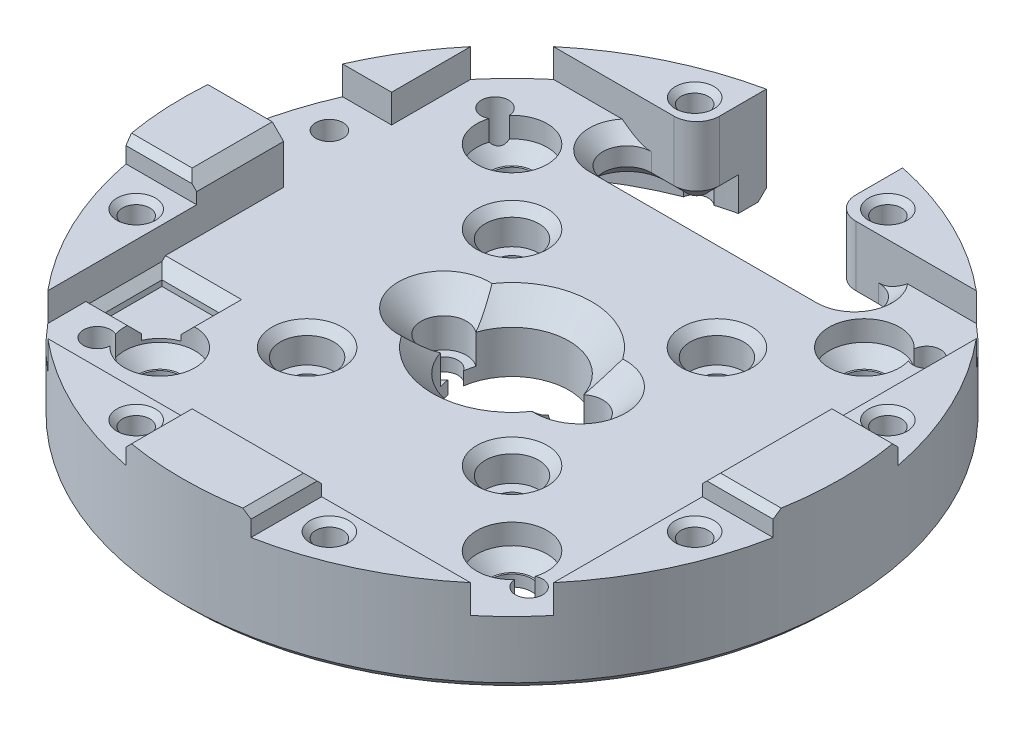
from build123d import *
from build123d.topology import SkipClean

# Parameters (mm, degrees)
SKETCH1_R           = 8.75
BOSS_EXTRUDE1_DEPTH = 1.75
SKETCH2_R           = 2
CUT_EXTRUDE1_DEPTH  = 0.6
SKETCH3_R           = 29
SKETCH3_R_2         = 1.2
BOSS_EXTRUDE2_DEPTH = 6.5
SKETCH4_W           = 44.5
SKETCH4_H           = 44.5
CUT_EXTRUDE2_DEPTH  = 2.5
CHAMFER1_SIZE       = 0.5
CHAMFER2_SIZE       = 2
BOSS_EXTRUDE3_START = 1.75
SKETCH10_R          = 29
SKETCH10_R_2        = 26.6
BOSS_EXTRUDE3_DEPTH = 1.75
SKETCH5_R           = 1.75
CUT_EXTRUDE3_DEPTH  = 42.413313077
SKETCH7_W           = 12
SKETCH7_H           = 24.342543846
CUT_EXTRUDE5_DEPTH  = 12
SKETCH11_R          = 2.35
CUT_EXTRUDE8_DEPTH  = 3
SKETCH8_W           = 5
SKETCH8_H           = 5
CUT_EXTRUDE6_DEPTH  = 1.5
SKETCH12_R          = 1.4
CUT_EXTRUDE9_DEPTH  = 42.379342672
FILLET2_R           = 3
CHAMFER6_SIZE       = 0.7
BOSS_EXTRUDE5_DEPTH = 2
SKETCH15_R          = 1.2
CUT_EXTRUDE10_DEPTH = 42.833748338
CHAMFER7_SIZE       = 0.75
CUT_EXTRUDE7_START  = -2.5
SKETCH9_W           = 16.08555233
SKETCH9_H           = 9.5
CUT_EXTRUDE7_DEPTH  = 4.5
SKETCH16_R          = 3.1
CUT_EXTRUDE11_DEPTH = 3
CHAMFER8_SIZE       = 1.2
CHAMFER9_SIZE       = 0.5
CHAMFER10_SIZE      = 1
CHAMFER11_SIZE      = 1
CUT_EXTRUDE12_DEPTH = 42.413313077
FILLET3_R           = 2
CHAMFER12_SIZE      = 1.2
CHAMFER13_SIZE      = 0.6


with BuildPart() as part:
    # Sketch1 → Boss-Extrude1 (new body)
    with BuildSketch(Plane(origin=(0, 0, 0), x_dir=(1, 0, 0), z_dir=(0, 1, 0))):
        with Locations(Location((0, 0, 0), (0, 0, 270))):
            Circle(SKETCH1_R)
        with BuildLine():
            ThreePointArc((-4.953125, -0.683046656), (0, -5), (4.953125, -0.683046656))
            ThreePointArc((4.953125, -0.683046656), (7.25, 0), (4.953125, 0.683046656))
            ThreePointArc((4.953125, 0.683046656), (0, 5), (-4.953125, 0.683046656))
            ThreePointArc((-4.953125, 0.683046656), (-7.25, 0), (-4.953125, -0.683046656))
        make_face(mode=Mode.SUBTRACT)
    extrude(amount=BOSS_EXTRUDE1_DEPTH)

    # Sketch2 → Cut-Extrude1 (cut)
    with BuildSketch(Plane(origin=(0, 1.75, 0), x_dir=(1, 0, 0), z_dir=(0, 1, 0))):
        with Locations((-6, 0)):
            Circle(SKETCH2_R)
        with Locations((6, 0)):
            Circle(SKETCH2_R)
    extrude(amount=-CUT_EXTRUDE1_DEPTH, mode=Mode.SUBTRACT)

    # Sketch3 → Boss-Extrude2 (add)
    with BuildSketch(Plane.XZ.offset(-1.75)):
        with Locations(Location((0, 0, 0), (0, 0, 270))):
            Circle(SKETCH3_R)
        with Locations(Location((19, 17.5, 0), (0, 0, 270))):
            Circle(SKETCH3_R_2, mode=Mode.SUBTRACT)
        with Locations(Location((19, -17.5, 0), (0, 0, 270))):
            Circle(SKETCH3_R_2, mode=Mode.SUBTRACT)
        with Locations(Location((-19, -17.5, 0), (0, 0, 270))):
            Circle(SKETCH3_R_2, mode=Mode.SUBTRACT)
        with Locations(Location((-19, 17.5, 0), (0, 0, 270))):
            Circle(SKETCH3_R_2, mode=Mode.SUBTRACT)
        with BuildLine():
            ThreePointArc((-4.75, -1.5612495), (0, -5), (4.75, -1.5612495))
            ThreePointArc((4.75, -1.5612495), (8, 0), (4.75, 1.5612495))
            ThreePointArc((4.75, 1.5612495), (0, 5), (-4.75, 1.5612495))
            ThreePointArc((-4.75, 1.5612495), (-8, 0), (-4.75, -1.5612495))
        make_face(mode=Mode.SUBTRACT)
    extrude(amount=-BOSS_EXTRUDE2_DEPTH)

    # Sketch4 → Cut-Extrude2 (cut)
    with BuildSketch(Plane(origin=(0, 8.25, 0), x_dir=(1, 0, 0), z_dir=(0, 1, 0))):
        Rectangle(SKETCH4_W, SKETCH4_H)
    extrude(amount=-CUT_EXTRUDE2_DEPTH, mode=Mode.SUBTRACT)

    # Chamfer1
    chamfer1_edges = [part.edges().sort_by_distance(p)[0] for p in [
        (0, 0, -8.75),
    ]]
    chamfer(chamfer1_edges, length=CHAMFER1_SIZE)

    # Chamfer2
    chamfer2_edges = [part.edges().sort_by_distance(p)[0] for p in [
        (0, 5.75, -5),
        (0, 5.75, 5),
        (8, 5.75, 0),
        (-8, 5.75, 0),
    ]]
    chamfer(chamfer2_edges, length=CHAMFER2_SIZE)

    # Sketch10 → Boss-Extrude3 (add)
    with BuildSketch(Plane.XZ.offset(-1.75).offset(BOSS_EXTRUDE3_START)):
        with Locations(Location((0, 0, 0), (0, 0, 270))):
            Circle(SKETCH10_R)
        with Locations(Location((0, 0, 0), (0, 0, 44.660730664))):
            Circle(SKETCH10_R_2, mode=Mode.SUBTRACT)
    extrude(amount=-BOSS_EXTRUDE3_DEPTH)

    # Sketch5 → Cut-Extrude3 (cut, through all)
    with BuildSketch(Plane(origin=(0, 5.75, 0), x_dir=(1, 0, 0), z_dir=(0, 1, 0))):
        with Locations(Location((-15.499780644, 15.499780644, 0), (0, 0, 270))):
            Circle(SKETCH5_R)
        with Locations(Location((15.499780644, 15.499780644, 0), (0, 0, 270))):
            Circle(SKETCH5_R)
        with Locations(Location((15.499780644, -15.499780644, 0), (0, 0, 270))):
            Circle(SKETCH5_R)
        with Locations(Location((-15.499780644, -15.499780644, 0), (0, 0, 270))):
            Circle(SKETCH5_R)
    extrude(amount=-CUT_EXTRUDE3_DEPTH, mode=Mode.SUBTRACT)

    # Sketch7 → Cut-Extrude5 (cut)
    with BuildSketch(Plane(origin=(0, 8.25, 0), x_dir=(1, 0, 0), z_dir=(0, 1, 0))):
        with Locations((0, 30.171271923)):
            Rectangle(SKETCH7_W, SKETCH7_H)
    extrude(amount=-CUT_EXTRUDE5_DEPTH, mode=Mode.SUBTRACT)

    # Sketch11 → Cut-Extrude8 (cut)
    with BuildSketch(Plane(origin=(0, 5.75, 0), x_dir=(1, 0, 0), z_dir=(0, 1, 0))):
        with Locations(Location((-9.01561146, 9.01561146, 0), (0, 0, 270))):
            Circle(SKETCH11_R)
        with Locations(Location((9.01561146, 9.01561146, 0), (0, 0, 270))):
            Circle(SKETCH11_R)
        with Locations(Location((9.01561146, -9.01561146, 0), (0, 0, 270))):
            Circle(SKETCH11_R)
        with Locations(Location((-9.01561146, -9.01561146, 0), (0, 0, 270))):
            Circle(SKETCH11_R)
    extrude(amount=-CUT_EXTRUDE8_DEPTH, mode=Mode.SUBTRACT)

    # Sketch8 → Cut-Extrude6 (cut)
    with BuildSketch(Plane(origin=(0, 5.75, 0), x_dir=(1, 0, 0), z_dir=(0, 1, 0))):
        with Locations((-19.05, -11.75)):
            Rectangle(SKETCH8_W, SKETCH8_H)
    extrude(amount=-CUT_EXTRUDE6_DEPTH, mode=Mode.SUBTRACT)

    # Sketch12 → Cut-Extrude9 (cut, through all)
    with BuildSketch(Plane(origin=(0, 2.75, 0), x_dir=(1, 0, 0), z_dir=(0, 1, 0))):
        with Locations(Location((-9.01561146, 9.01561146, 0), (0, 0, 270))):
            Circle(SKETCH12_R)
        with Locations(Location((9.01561146, 9.01561146, 0), (0, 0, 270))):
            Circle(SKETCH12_R)
        with Locations(Location((9.01561146, -9.01561146, 0), (0, 0, 270))):
            Circle(SKETCH12_R)
        with Locations(Location((-9.01561146, -9.01561146, 0), (0, 0, 270))):
            Circle(SKETCH12_R)
    extrude(amount=-CUT_EXTRUDE9_DEPTH, mode=Mode.SUBTRACT)

    # Fillet2
    fillet2_edges = [part.edges().sort_by_distance(p)[0] for p in [
        (6, 3.75, -18),
        (-6, 3.75, -18),
    ]]
    fillet(fillet2_edges, radius=FILLET2_R)

    # Chamfer6
    chamfer6_edges = [part.edges().sort_by_distance(p)[0] for p in [
        (0, 0, 29),
    ]]
    chamfer(chamfer6_edges, length=CHAMFER6_SIZE)

    # Sketch14 → Boss-Extrude5 (add)
    with SkipClean():  # the faces are left unmerged after this step: merging them gives an invalid solid
        with BuildSketch(Plane(origin=(0, 8.25, 0), x_dir=(1, 0, 0), z_dir=(0, 1, 0))):
            with BuildLine():
                Line((22.25, 5.5), (22.25, -5.5))
                Line((22.25, -5.5), (28.47367205, -5.5))
                ThreePointArc((28.47367205, -5.5), (29, 0), (28.47367205, 5.5))
                Line((28.47367205, 5.5), (22.25, 5.5))
            make_face()
            with BuildLine():
                Line((5.5, -22.25), (-5.5, -22.25))
                Line((-5.5, -22.25), (-5.5, -28.47367205))
                ThreePointArc((-5.5, -28.47367205), (0, -29), (5.5, -28.47367205))
                Line((5.5, -28.47367205), (5.5, -22.25))
            make_face()
            with BuildLine():
                Line((-22.25, -5.5), (-22.25, 5.5))
                Line((-22.25, 5.5), (-28.47367205, 5.5))
                ThreePointArc((-28.47367205, 5.5), (-29, 0), (-28.47367205, -5.5))
                Line((-28.47367205, -5.5), (-22.25, -5.5))
            make_face()
        extrude(amount=BOSS_EXTRUDE5_DEPTH)

    # Sketch15 → Cut-Extrude10 (cut, through all)
    with SkipClean():  # the faces are left unmerged after this step: merging them gives an invalid solid
        with BuildSketch(Plane(origin=(0, 8.25, 0), x_dir=(1, 0, 0), z_dir=(0, 1, 0))):
            with Locations(Location((24.571324751, 8.5, 0), (0, 0, 270))):
                Circle(SKETCH15_R)
            with Locations(Location((24.571324751, -8.5, 0), (0, 0, 270))):
                Circle(SKETCH15_R)
            with Locations(Location((8.5, -24.571324751, 0), (0, 0, 270))):
                Circle(SKETCH15_R)
            with Locations(Location((-8.5, -24.571324751, 0), (0, 0, 270))):
                Circle(SKETCH15_R)
            with Locations(Location((-24.571324751, -8.5, 0), (0, 0, 270))):
                Circle(SKETCH15_R)
            with Locations(Location((-24.571324751, 8.5, 0), (0, 0, 270))):
                Circle(SKETCH15_R)
            with Locations(Location((-8.5, 24.571324751, 0), (0, 0, 270))):
                Circle(SKETCH15_R)
            with Locations(Location((8.5, 24.571324751, 0), (0, 0, 270))):
                Circle(SKETCH15_R)
        extrude(amount=-CUT_EXTRUDE10_DEPTH, mode=Mode.SUBTRACT)

    # Chamfer7
    chamfer7_edges = [part.edges().sort_by_distance(p)[0] for p in [
        (-9.01561146, 5.75, 6.66561146),
        (9.01561146, 5.75, 6.66561146),
        (9.01561146, 5.75, -11.36561146),
        (-9.01561146, 5.75, -11.36561146),
    ]]
    chamfer(chamfer7_edges, length=CHAMFER7_SIZE)

    # Sketch9 → Cut-Extrude7 (cut)
    with SkipClean():  # the faces are left unmerged after this step: merging them gives an invalid solid
        with BuildSketch(Plane(origin=(0, 8.25, 0), x_dir=(1, 0, 0), z_dir=(0, 1, 0)).offset(CUT_EXTRUDE7_START)):
            with Locations((-27.18622894, 6.9)):
                Rectangle(SKETCH9_W, SKETCH9_H)
        extrude(amount=CUT_EXTRUDE7_DEPTH, mode=Mode.SUBTRACT)

    # Sketch16 → Cut-Extrude11 (cut)
    with SkipClean():  # the faces are left unmerged after this step: merging them gives an invalid solid
        with BuildSketch(Plane(origin=(0, 5.75, 0), x_dir=(1, 0, 0), z_dir=(0, 1, 0))):
            with Locations((-15.499780644, 15.499780644)):
                Circle(SKETCH16_R)
            with Locations((15.499780644, 15.499780644)):
                Circle(SKETCH16_R)
            with Locations((15.499780644, -15.499780644)):
                Circle(SKETCH16_R)
            with Locations((-15.499780644, -15.499780644)):
                Circle(SKETCH16_R)
        extrude(amount=-CUT_EXTRUDE11_DEPTH, mode=Mode.SUBTRACT)

    # Chamfer8
    # the kernel refuses this chamfer: 1.2 mm, written as the material it adds along each edge
    with BuildSketch(Plane(origin=(-15.499780644, 2.75, -15.499780644), x_dir=(-0.26542411550444084, 0, -0.9641317539157629), z_dir=(0.9641317539157629, 0, -0.26542411550444084))) as chamfer8_piece_1_section:
        Polygon((3.1, CHAMFER8_SIZE), (3.1 - CHAMFER8_SIZE, 0), (3.1, 0), align=None)
    chamfer8_piece_1 = revolve(axis=Axis((-15.499780644, 2.75, -15.499780644), (0, 1, 0)), revolution_arc=254.607844674, mode=Mode.PRIVATE)
    chamfer8_piece_1 = chamfer8_piece_1 - Plane(origin=(-19, 3.335180824, -17.5), x_dir=(0, 0, -1), z_dir=(0, -1, 0)) * Cylinder(1.2, 13, mode=Mode.PRIVATE)
    add(chamfer8_piece_1)
    with BuildSketch(Plane(origin=(-15.499780644, 2.75, 15.499780644), x_dir=(1, 0, 0), z_dir=(0, 0, 1))) as chamfer8_piece_2_section:
        Polygon((3.1, CHAMFER8_SIZE), (3.1 - CHAMFER8_SIZE, 0), (3.1, 0), align=None)
    chamfer8_piece_2 = revolve(axis=Axis((-15.499780644, 2.75, 15.499780644), (0, 1, 0)), revolution_arc=254.607844674, mode=Mode.PRIVATE)
    chamfer8_piece_2 = chamfer8_piece_2 - Plane(origin=(-19, 3.335180824, 17.5), x_dir=(0, 0, -1), z_dir=(0, -1, 0)) * Cylinder(1.2, 13, mode=Mode.PRIVATE)
    add(chamfer8_piece_2)
    with BuildSketch(Plane(origin=(15.499780644, 2.75, 15.499780644), x_dir=(1, 0, 0), z_dir=(0, 0, 1))) as chamfer8_piece_3_section:
        Polygon((3.1, CHAMFER8_SIZE), (3.1 - CHAMFER8_SIZE, 0), (3.1, 0), align=None)
    chamfer8_piece_3 = revolve(axis=Axis((15.499780644, 2.75, 15.499780644), (0, 1, 0)), revolution_arc=359.64, mode=Mode.PRIVATE)
    chamfer8_piece_3 = chamfer8_piece_3 - Plane(origin=(19, 3.333317196, 17.5), x_dir=(0, 0, -1), z_dir=(0, -1, 0)) * Cylinder(1.2, 13, mode=Mode.PRIVATE)
    add(chamfer8_piece_3)
    with BuildSketch(Plane(origin=(15.499780644, 2.75, -15.499780644), x_dir=(0.9999802608561372, 0, -0.00628314396555981), z_dir=(0.00628314396555981, 0, 0.9999802608561372))) as chamfer8_piece_4_section:
        Polygon((3.1, CHAMFER8_SIZE), (3.1 - CHAMFER8_SIZE, 0), (3.1, 0), align=None)
    chamfer8_piece_4 = revolve(axis=Axis((15.499780644, 2.75, -15.499780644), (0, 1, 0)), revolution_arc=359.64, mode=Mode.PRIVATE)
    chamfer8_piece_4 = chamfer8_piece_4 - Plane(origin=(19, 3.333317196, -17.5), x_dir=(0, 0, -1), z_dir=(0, -1, 0)) * Cylinder(1.2, 13, mode=Mode.PRIVATE)
    add(chamfer8_piece_4)
    with BuildSketch(Plane(origin=(15.499780644, 2.75, -15.499780644), x_dir=(1, 0, 0), z_dir=(0, 0, 1))) as chamfer8_piece_5_section:
        Polygon((3.1, CHAMFER8_SIZE), (3.1 - CHAMFER8_SIZE, 0), (3.1, 0), align=None)
    chamfer8_piece_5 = revolve(axis=Axis((15.499780644, 2.75, -15.499780644), (0, 1, 0)), revolution_arc=74.498296466, mode=Mode.PRIVATE)
    chamfer8_piece_5 = chamfer8_piece_5 - Plane(origin=(19, 3.144218853, -17.5), x_dir=(0, 0, -1), z_dir=(0, -1, 0)) * Cylinder(1.2, 13, mode=Mode.PRIVATE)
    add(chamfer8_piece_5)
    with BuildSketch(Plane(origin=(15.499780644, 2.75, 15.499780644), x_dir=(0.2672670268853943, 0, 0.9636225071779104), z_dir=(-0.9636225071779104, 0, 0.2672670268853943))) as chamfer8_piece_6_section:
        Polygon((3.1, CHAMFER8_SIZE), (3.1 - CHAMFER8_SIZE, 0), (3.1, 0), align=None)
    chamfer8_piece_6 = revolve(axis=Axis((15.499780644, 2.75, 15.499780644), (0, 1, 0)), revolution_arc=74.498296466, mode=Mode.PRIVATE)
    chamfer8_piece_6 = chamfer8_piece_6 - Plane(origin=(19, 3.144218851, 17.5), x_dir=(0, 0, -1), z_dir=(0, -1, 0)) * Cylinder(1.2, 13, mode=Mode.PRIVATE)
    add(chamfer8_piece_6)
    with BuildSketch(Plane(origin=(-15.499780644, 2.75, 15.499780644), x_dir=(-0.9656578143230343, 0, -0.2598172158207769), z_dir=(0.2598172158207769, 0, -0.9656578143230343))) as chamfer8_piece_7_section:
        Polygon((3.1, CHAMFER8_SIZE), (3.1 - CHAMFER8_SIZE, 0), (3.1, 0), align=None)
    chamfer8_piece_7 = revolve(axis=Axis((-15.499780644, 2.75, 15.499780644), (0, 1, 0)), revolution_arc=195.059216658, mode=Mode.PRIVATE)
    chamfer8_piece_7 = chamfer8_piece_7 - Plane(origin=(-19, 3.336487733, 17.5), x_dir=(0, 0, -1), z_dir=(0, -1, 0)) * Cylinder(1.2, 13, mode=Mode.PRIVATE)
    add(chamfer8_piece_7)
    with BuildSketch(Plane(origin=(-15.499780644, 2.75, -15.499780644), x_dir=(1, 0, 0), z_dir=(0, 0, 1))) as chamfer8_piece_8_section:
        Polygon((3.1, CHAMFER8_SIZE), (3.1 - CHAMFER8_SIZE, 0), (3.1, 0), align=None)
    chamfer8_piece_8 = revolve(axis=Axis((-15.499780644, 2.75, -15.499780644), (0, 1, 0)), revolution_arc=195.059216658, mode=Mode.PRIVATE)
    chamfer8_piece_8 = chamfer8_piece_8 - Plane(origin=(-19, 3.336487733, -17.5), x_dir=(0, 0, -1), z_dir=(0, -1, 0)) * Cylinder(1.2, 13, mode=Mode.PRIVATE)
    add(chamfer8_piece_8)

    # Chamfer9
    chamfer9_edges = [part.edges().sort_by_distance(p)[0] for p in [
        (8.5, 8.25, -25.771324751),
        (-8.5, 8.25, -25.771324751),
        (-24.571324751, 8.25, 7.3),
        (-8.5, 8.25, 23.371324751),
        (8.5, 8.25, 23.371324751),
        (24.571324751, 8.25, 7.3),
        (24.571324751, 8.25, -9.7),
    ]]
    chamfer(chamfer9_edges, length=CHAMFER9_SIZE)

    # Chamfer10
    # the kernel refuses this chamfer: 1 mm, written as the material it takes off along each edge
    with BuildSketch(Plane(origin=(-16.55, 5.75, 9.25), x_dir=(0, 0.02749587661058651, -0.9996219169112968), z_dir=(-1, 0, 0))) as chamfer10_piece_1:
        Polygon((CHAMFER10_SIZE * 0.999621916911, CHAMFER10_SIZE * 0.0274958766106), (-CHAMFER10_SIZE * 0.0274958766106, CHAMFER10_SIZE * 0.999621916911), (0, 0), align=None)
    extrude(amount=5, mode=Mode.SUBTRACT)
    with BuildSketch(Plane(origin=(-21.55, 5.75, 9.25), x_dir=(-0.9996219169112968, 0.02749587661058651, 0), z_dir=(0, 0, 1))) as chamfer10_piece_2_section:
        Polygon((CHAMFER10_SIZE * 0.999621916911, CHAMFER10_SIZE * 0.0274958766106), (-CHAMFER10_SIZE * 0.0274958766106, CHAMFER10_SIZE * 0.999621916911), (0, 0), align=None)
    chamfer10_piece_2 = extrude(amount=5, mode=Mode.PRIVATE)
    chamfer10_piece_2 = split(chamfer10_piece_2, bisect_by=Plane(origin=(-22.25, 5.391032251, 11.75), z_dir=(1, 0, 0)), keep=Keep.TOP, mode=Mode.PRIVATE)
    add(chamfer10_piece_2, mode=Mode.SUBTRACT)
    with BuildSketch(Plane(origin=(-21.55, 5.75, 14.25), x_dir=(0, 0.02749587661058651, 0.9996219169112968), z_dir=(1, 0, 0))) as chamfer10_piece_3:
        Polygon((CHAMFER10_SIZE * 0.999621916911, CHAMFER10_SIZE * 0.0274958766106), (-CHAMFER10_SIZE * 0.0274958766106, CHAMFER10_SIZE * 0.999621916911), (0, 0), align=None)
    extrude(amount=5.784994108, mode=Mode.SUBTRACT)
    with BuildSketch(Plane(origin=(-16.55, 5.75, 15.154780703), x_dir=(0.9996219169112968, 0.02749587661058651, 0), z_dir=(0, 0, -1))) as chamfer10_piece_4:
        Polygon((CHAMFER10_SIZE * 0.999621916911, CHAMFER10_SIZE * 0.0274958766106), (-CHAMFER10_SIZE * 0.0274958766106, CHAMFER10_SIZE * 0.999621916911), (0, 0), align=None)
    extrude(amount=5.904780703, mode=Mode.SUBTRACT)
    with BuildSketch(Plane(origin=(-16.55, 5.75, 15.154780703), x_dir=(0.9996219169112968, 0.02749587661058651, 0), z_dir=(0, 0, -1))) as chamfer10_piece_5a_section:
        Polygon((CHAMFER10_SIZE * 0.999621916911, CHAMFER10_SIZE * 0.0274958766106), (-CHAMFER10_SIZE * 0.0274958766106, CHAMFER10_SIZE * 0.999621916911), (0, 0), align=None)
    chamfer10_piece_5a = extrude(amount=8.476463691, mode=Mode.PRIVATE)
    chamfer10_piece_5a = split(chamfer10_piece_5a, bisect_by=Plane(origin=(-16.220206373, 5.420206373, 9.25), z_dir=(0, 0, -1)), keep=Keep.TOP, mode=Mode.PRIVATE)
    with BuildSketch(Plane(origin=(-13.978317012, 5.75, 9.25), x_dir=(0, 0.02749587661058651, -0.9996219169112968), z_dir=(-1, 0, 0))) as chamfer10_piece_5b_section:
        Polygon((CHAMFER10_SIZE * 0.999621916911, CHAMFER10_SIZE * 0.0274958766106), (-CHAMFER10_SIZE * 0.0274958766106, CHAMFER10_SIZE * 0.999621916911), (0, 0), align=None)
    chamfer10_piece_5b = extrude(amount=7.571682988, mode=Mode.PRIVATE)
    chamfer10_piece_5b = split(chamfer10_piece_5b, bisect_by=Plane(origin=(-16.55, 5.420206373, 8.920206373), z_dir=(1, 0, 0)), keep=Keep.TOP, mode=Mode.PRIVATE)
    chamfer10_piece_5 = chamfer10_piece_5a & chamfer10_piece_5b
    add(chamfer10_piece_5, mode=Mode.SUBTRACT)
    with BuildSketch(Plane(origin=(-16.55, 5.75, 9.25), x_dir=(0, 0.02749587661058651, -0.9996219169112968), z_dir=(-1, 0, 0))) as chamfer10_piece_6a_section:
        Polygon((CHAMFER10_SIZE * 0.999621916911, CHAMFER10_SIZE * 0.0274958766106), (-CHAMFER10_SIZE * 0.0274958766106, CHAMFER10_SIZE * 0.999621916911), (0, 0), align=None)
    chamfer10_piece_6a = extrude(amount=7.571682988, mode=Mode.PRIVATE)
    chamfer10_piece_6a = split(chamfer10_piece_6a, bisect_by=Plane(origin=(-22.25, 5.420206373, 8.920206373), z_dir=(1, 0, 0)), keep=Keep.TOP, mode=Mode.PRIVATE)
    chamfer10_piece_6a = split(chamfer10_piece_6a, bisect_by=Plane(origin=(-21.55, 5.420206373, 8.920206373), z_dir=(-1, 0, 0)), keep=Keep.TOP, mode=Mode.PRIVATE)
    with BuildSketch(Plane(origin=(-21.55, 5.75, 6.678317012), x_dir=(-0.9996219169112968, 0.02749587661058651, 0), z_dir=(0, 0, 1))) as chamfer10_piece_6b_section:
        Polygon((CHAMFER10_SIZE * 0.999621916911, CHAMFER10_SIZE * 0.0274958766106), (-CHAMFER10_SIZE * 0.0274958766106, CHAMFER10_SIZE * 0.999621916911), (0, 0), align=None)
    chamfer10_piece_6b = extrude(amount=7.571682988, mode=Mode.PRIVATE)
    chamfer10_piece_6b = split(chamfer10_piece_6b, bisect_by=Plane(origin=(-22.25, 5.391032251, 7.964158506), z_dir=(1, 0, 0)), keep=Keep.TOP, mode=Mode.PRIVATE)
    chamfer10_piece_6b = split(chamfer10_piece_6b, bisect_by=Plane(origin=(-21.824069638, 5.391032251, 9.25), z_dir=(0, 0, -1)), keep=Keep.TOP, mode=Mode.PRIVATE)
    chamfer10_piece_6 = chamfer10_piece_6a & chamfer10_piece_6b
    add(chamfer10_piece_6, mode=Mode.SUBTRACT)
    with BuildSketch(Plane(origin=(-21.55, 5.75, 9.25), x_dir=(-0.9996219169112968, 0.02749587661058651, 0), z_dir=(0, 0, 1))) as chamfer10_piece_7a_section:
        Polygon((CHAMFER10_SIZE * 0.999621916911, CHAMFER10_SIZE * 0.0274958766106), (-CHAMFER10_SIZE * 0.0274958766106, CHAMFER10_SIZE * 0.999621916911), (0, 0), align=None)
    chamfer10_piece_7a = extrude(amount=7.571682988, mode=Mode.PRIVATE)
    chamfer10_piece_7a = split(chamfer10_piece_7a, bisect_by=Plane(origin=(-22.25, 5.391032251, 15.535841494), z_dir=(1, 0, 0)), keep=Keep.TOP, mode=Mode.PRIVATE)
    chamfer10_piece_7a = split(chamfer10_piece_7a, bisect_by=Plane(origin=(-21.824069638, 5.391032251, 14.25), z_dir=(0, 0, 1)), keep=Keep.TOP, mode=Mode.PRIVATE)
    with BuildSketch(Plane(origin=(-24.121682988, 5.75, 14.25), x_dir=(0, 0.02749587661058651, 0.9996219169112968), z_dir=(1, 0, 0))) as chamfer10_piece_7b_section:
        Polygon((CHAMFER10_SIZE * 0.999621916911, CHAMFER10_SIZE * 0.0274958766106), (-CHAMFER10_SIZE * 0.0274958766106, CHAMFER10_SIZE * 0.999621916911), (0, 0), align=None)
    chamfer10_piece_7b = extrude(amount=8.356677096, mode=Mode.PRIVATE)
    chamfer10_piece_7b = split(chamfer10_piece_7b, bisect_by=Plane(origin=(-22.25, 5.420206373, 14.579793627), z_dir=(1, 0, 0)), keep=Keep.TOP, mode=Mode.PRIVATE)
    chamfer10_piece_7b = split(chamfer10_piece_7b, bisect_by=Plane(origin=(-21.55, 5.420206373, 14.579793627), z_dir=(-1, 0, 0)), keep=Keep.TOP, mode=Mode.PRIVATE)
    chamfer10_piece_7 = chamfer10_piece_7a & chamfer10_piece_7b
    add(chamfer10_piece_7, mode=Mode.SUBTRACT)

    # Chamfer11
    chamfer11_edges = [part.edges().sort_by_distance(p)[0] for p in [
        (22.25, 10.25, 0),
        (0, 10.25, 22.25),
        (-22.25, 10.25, 1.675),
    ]]
    chamfer(chamfer11_edges, length=CHAMFER11_SIZE)

    # Sketch17 → Cut-Extrude12 (cut, through all)
    with BuildSketch(Plane(origin=(0, 5.75, 0), x_dir=(1, 0, 0), z_dir=(0, 1, 0))):
        with BuildLine():
            Line((-10, 22.25), (10, 22.25))
            ThreePointArc((10, 22.25), (12.125, 20.125), (10, 18))
            Line((10, 18), (-10, 18))
            ThreePointArc((-10, 18), (-12.125, 20.125), (-10, 22.25))
        make_face()
    extrude(amount=-CUT_EXTRUDE12_DEPTH, mode=Mode.SUBTRACT)

    # Fillet3
    fillet3_edges = [part.edges().sort_by_distance(p)[0] for p in [
        (6, 3.75, -22.25),
        (-6, 3.75, -22.25),
    ]]
    fillet(fillet3_edges, radius=FILLET3_R)

    # Chamfer12
    # the kernel refuses this chamfer: 1.2 mm, written as the material it takes off along each edge
    with BuildSketch(Plane(origin=(6, 1.75, -24.25), x_dir=(-0.027495876610586632, 0.9996219169112968, 0), z_dir=(0, 0, -1))) as chamfer12_piece_1_section:
        Polygon((CHAMFER12_SIZE * 0.999621916911, CHAMFER12_SIZE * 0.0274958766106), (-CHAMFER12_SIZE * 0.0274958766106, CHAMFER12_SIZE * 0.999621916911), (0, 0), align=None)
    chamfer12_piece_1 = extrude(amount=4.750494305, mode=Mode.PRIVATE)
    chamfer12_piece_1 = chamfer12_piece_1 & Plane(origin=(0, 2.261864146, 0), x_dir=(0.7112813989926423, 0, 0.7029073704600554), z_dir=(0, -1, 0)) * Cylinder(26.6, 15, mode=Mode.PRIVATE)
    add(chamfer12_piece_1, mode=Mode.SUBTRACT)
    with BuildSketch(Plane(origin=(-3, 1.75, -18), x_dir=(0, 0.9996219169112968, -0.027495876610587354), z_dir=(1, 0, 0))) as chamfer12_piece_2:
        Polygon((CHAMFER12_SIZE * 0.999621916911, CHAMFER12_SIZE * 0.0274958766106), (-CHAMFER12_SIZE * 0.0274958766106, CHAMFER12_SIZE * 0.999621916911), (0, 0), align=None)
    extrude(amount=6, mode=Mode.SUBTRACT)
    with BuildSketch(Plane(origin=(-3, 5.75, -18), x_dir=(0, -0.9996219169112968, -0.027495876610587344), z_dir=(1, 0, 0))) as chamfer12_piece_3:
        Polygon((CHAMFER12_SIZE * 0.999621916911, -CHAMFER12_SIZE * 0.0274958766106), (-CHAMFER12_SIZE * 0.0274958766106, -CHAMFER12_SIZE * 0.999621916911), (0, 0), align=None)
    extrude(amount=6, mode=Mode.SUBTRACT)
    with BuildSketch(Plane(origin=(-10, 1.75, -20.125), x_dir=(0, 0, -1), z_dir=(1, 0, 0))) as chamfer12_piece_4:
        Polygon((2.125, CHAMFER12_SIZE), (2.125 + CHAMFER12_SIZE, 0), (2.125, 0), align=None)
    revolve(axis=Axis((-10, 1.75, -20.125), (0, 1, 0)), revolution_arc=180, mode=Mode.SUBTRACT)
    with BuildSketch(Plane(origin=(10, 1.75, -20.125), x_dir=(0, 0, 1), z_dir=(-1, 0, 0))) as chamfer12_piece_5:
        Polygon((2.125, CHAMFER12_SIZE), (2.125 + CHAMFER12_SIZE, 0), (2.125, 0), align=None)
    revolve(axis=Axis((10, 1.75, -20.125), (0, 1, 0)), revolution_arc=180, mode=Mode.SUBTRACT)
    with BuildSketch(Plane(origin=(-8, 1.75, -22.25), x_dir=(0, 0.9996219169112968, 0.027495876610587354), z_dir=(-1, 0, 0)), Plane(origin=(10, 1.75, -22.25), x_dir=(0, 0.9996219169112968, 0.027495876610587354), z_dir=(-1, 0, 0))) as chamfer12_piece_6:
        Polygon((CHAMFER12_SIZE * 0.999621916911, CHAMFER12_SIZE * 0.0274958766106), (-CHAMFER12_SIZE * 0.0274958766106, CHAMFER12_SIZE * 0.999621916911), (0, 0), align=None)
    extrude(amount=2, mode=Mode.SUBTRACT)
    with BuildSketch(Plane(origin=(-10, 5.75, -20.125), x_dir=(0, 0, 1), z_dir=(1, 0, 0))) as chamfer12_piece_7_section:
        Polygon((2.125, CHAMFER12_SIZE), (2.125 + CHAMFER12_SIZE, 0), (2.125, 0), align=None)
    chamfer12_piece_7 = revolve(axis=Axis((-10, 5.75, -20.125), (0, -1, 0)), revolution_arc=263.341294656, mode=Mode.PRIVATE)
    chamfer12_piece_7 = split(chamfer12_piece_7, bisect_by=Plane(origin=(-12.714015353, 5.160984647, -22.25), z_dir=(0, 0, 1)), keep=Keep.TOP, mode=Mode.PRIVATE)
    add(chamfer12_piece_7, mode=Mode.SUBTRACT)
    with BuildSketch(Plane(origin=(10, 5.75, -20.125), x_dir=(-0.9932544794138845, 0, -0.11595490125153599), z_dir=(-0.11595490125153599, 0, 0.9932544794138845))) as chamfer12_piece_8_section:
        Polygon((2.125, CHAMFER12_SIZE), (2.125 + CHAMFER12_SIZE, 0), (2.125, 0), align=None)
    chamfer12_piece_8 = revolve(axis=Axis((10, 5.75, -20.125), (0, -1, 0)), revolution_arc=263.341294656, mode=Mode.PRIVATE)
    chamfer12_piece_8 = split(chamfer12_piece_8, bisect_by=Plane(origin=(12.714015353, 5.160984647, -22.25), z_dir=(0, 0, 1)), keep=Keep.TOP, mode=Mode.PRIVATE)
    add(chamfer12_piece_8, mode=Mode.SUBTRACT)
    with BuildSketch(Plane(origin=(-6, 1.75, -29.000494305), x_dir=(0.027495876610586632, 0.9996219169112968, 0), z_dir=(0, 0, 1))) as chamfer12_piece_9_section:
        Polygon((CHAMFER12_SIZE * 0.999621916911, CHAMFER12_SIZE * 0.0274958766106), (-CHAMFER12_SIZE * 0.0274958766106, CHAMFER12_SIZE * 0.999621916911), (0, 0), align=None)
    chamfer12_piece_9 = extrude(amount=4.750494305, mode=Mode.PRIVATE)
    chamfer12_piece_9 = chamfer12_piece_9 & Plane(origin=(0, 2.261864146, 0), x_dir=(0.7112813989926423, 0, 0.7029073704600554), z_dir=(0, -1, 0)) * Cylinder(26.6, 15, mode=Mode.PRIVATE)
    add(chamfer12_piece_9, mode=Mode.SUBTRACT)
    with BuildSketch(Plane(origin=(-8, 1.75, -24.25), x_dir=(1, 0, 0), z_dir=(0, 0, -1))) as chamfer12_piece_10:
        Polygon((2, -CHAMFER12_SIZE), (2 - CHAMFER12_SIZE, 0), (2, 0), align=None)
    revolve(axis=Axis((-8, 1.75, -24.25), (0, -1, 0)), revolution_arc=90, mode=Mode.SUBTRACT)
    with BuildSketch(Plane(origin=(8, 1.75, -24.25), x_dir=(-1, 0, 0), z_dir=(0, 0, -1))) as chamfer12_piece_11:
        Polygon((2, CHAMFER12_SIZE), (2 - CHAMFER12_SIZE, 0), (2, 0), align=None)
    revolve(axis=Axis((8, 1.75, -24.25), (0, 1, 0)), revolution_arc=90, mode=Mode.SUBTRACT)
    with BuildSketch(Plane(origin=(10, 5.75, -18), x_dir=(0, -0.9996219169112968, -0.027495876610587344), z_dir=(-1, 0, 0)), Plane(origin=(-3, 5.75, -18), x_dir=(0, -0.9996219169112968, -0.027495876610587344), z_dir=(-1, 0, 0)), Plane(origin=(3, 1.75, -18), x_dir=(0, 0.9996219169112968, -0.027495876610587354), z_dir=(1, 0, 0)), Plane(origin=(-10, 1.75, -18), x_dir=(0, 0.9996219169112968, -0.027495876610587354), z_dir=(1, 0, 0))) as chamfer12_piece_12:
        Polygon((CHAMFER12_SIZE * 0.999621916911, CHAMFER12_SIZE * 0.0274958766106), (-CHAMFER12_SIZE * 0.0274958766106, CHAMFER12_SIZE * 0.999621916911), (0, 0), align=None)
    extrude(amount=7, mode=Mode.SUBTRACT)

    # Chamfer13
    chamfer13_edges = [part.edges().sort_by_distance(p)[0] for p in [
        (25.861836025, 10.25, -5.5),
        (5.5, 10.25, 25.861836025),
        (-25.861836025, 10.25, 5.5),
        (25.861836025, 10.25, 5.5),
        (-5.5, 10.25, 25.861836025),
    ]]
    chamfer(chamfer13_edges, length=CHAMFER13_SIZE)


solid = part.part
